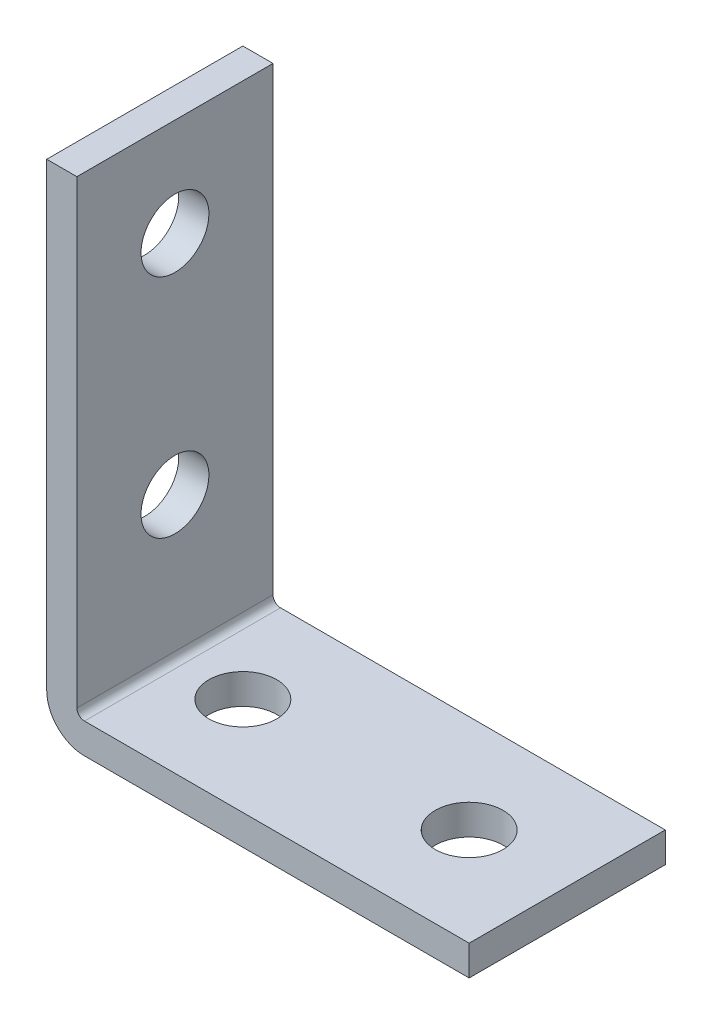
from build123d import *

# Parameters (mm, degrees)
EXTRUDE_THIN1_DEPTH = 20.6375
SKETCH2_R           = 7.14375
CUT_EXTRUDE1_DEPTH  = 135.225917882
SKETCH3_R           = 7.14375
CUT_EXTRUDE2_DEPTH  = 135.974847773


with BuildPart() as part:
    # Sketch1 → Extrude-Thin1 (new, symmetric)
    with BuildSketch(Plane.XY):
        with BuildLine():
            Line((0, 104.775), (0, 7.9375))
            ThreePointArc((0, 7.9375), (2.324839924, 2.324839924), (7.9375, 0))
            Line((7.9375, 0), (88.9, 0))
            Line((88.9, 0), (88.9, 6.35))
            Line((88.9, 6.35), (7.9375, 6.35))
            ThreePointArc((7.9375, 6.35), (6.814967985, 6.814967985), (6.35, 7.9375))
            Line((6.35, 7.9375), (6.35, 104.775))
            Line((6.35, 104.775), (0, 104.775))
        make_face()
    extrude(amount=EXTRUDE_THIN1_DEPTH, both=True)

    # Sketch2 → Cut-Extrude1 (cut, through all)
    with BuildSketch(Plane(origin=(0, 6.35, 0), x_dir=(1, 0, 0), z_dir=(0, 1, 0))):
        with Locations((68.2625, 0)):
            Circle(SKETCH2_R)
        with Locations((20.6375, 0)):
            Circle(SKETCH2_R)
    extrude(amount=-CUT_EXTRUDE1_DEPTH, mode=Mode.SUBTRACT)

    # Sketch3 → Cut-Extrude2 (cut, through all)
    with BuildSketch(Plane(origin=(6.35, 0, 0), x_dir=(0, 0, -1), z_dir=(1, 0, 0))):
        with Locations((0, 84.1375)):
            Circle(SKETCH3_R)
        with Locations((0, 36.5125)):
            Circle(SKETCH3_R)
    extrude(amount=-CUT_EXTRUDE2_DEPTH, mode=Mode.SUBTRACT)


solid = part.part
